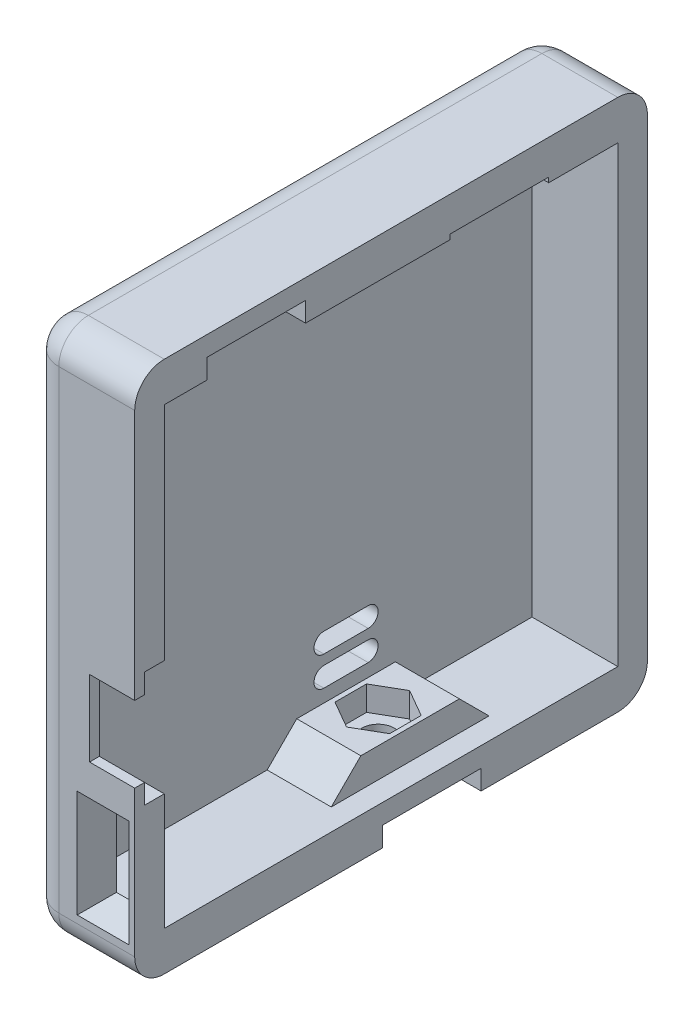
from build123d import *

# Parameters (mm, degrees)
CROQUIS1_W                   = 3.246579248
CROQUIS1_H                   = 8.852829877
SALIENTE_EXTRUIR1_DEPTH      = 2
CROQUIS5_W                   = 9
CROQUIS5_H                   = 0.5
ARREGLO_IMPRESION1_DEPTH     = 2
CROQUIS6_W                   = 9
CROQUIS6_H                   = 48
SALIENTE_EXTRUIR4_DEPTH      = 2
CROQUIS7_W                   = 9
CROQUIS7_H                   = 48
SALIENTE_EXTRUIR5_DEPTH      = 2
CROQUIS8_W                   = 9
CROQUIS8_H                   = 50
SALIENTE_EXTRUIR6_DEPTH      = 2
SALIENTE_EXTRUIR7_DEPTH      = 1.7
SALIENTE_EXTRUIR7_DEPTH_BACK = 0.3
CROQUIS9_W                   = 50
CROQUIS9_H                   = 50
CROQUIS10_W                  = 10
CROQUIS10_H                  = 0.5
CORTAR_EXTRUIR1_DEPTH        = 8.700001
CROQUIS11_W                  = 3.246579248
CROQUIS11_H                  = 8.852829877
SALIENTE_EXTRUIR8_DEPTH      = 1
CROQUIS12_W                  = 10.7
CROQUIS12_H                  = 51
SALIENTE_EXTRUIR9_DEPTH      = 2
CROQUIS13_W                  = 10.7
CROQUIS13_H                  = 52
SALIENTE_EXTRUIR10_DEPTH     = 1
CROQUIS14_W                  = 10.7
CROQUIS14_H                  = 52
SALIENTE_EXTRUIR11_DEPTH     = 2
SALIENTE_EXTRUIR12_DEPTH     = 6.5
CORTAR_EXTRUIR2_START        = -7
CROQUIS19_R                  = 1.625
CORTAR_EXTRUIR2_DEPTH        = 7
CORTAR_EXTRUIR3_DEPTH        = 2.5
CROQUIS22_W                  = 10
CROQUIS22_H                  = 2
CORTAR_EXTRUIR4_DEPTH        = 8.7
CORTAR_EXTRUIR5_START        = -10.7
CORTAR_EXTRUIR5_DEPTH        = 10.7
REDONDEO4_R                  = 3
CROQUIS24_W                  = 5.246579248
CROQUIS24_H                  = 10.87000641
CORTAR_EXTRUIR6_DEPTH        = 3
CORTAR_EXTRUIR6_DRAFT        = -18
CROQUIS25_W                  = 6.58
CROQUIS25_H                  = 11.7
CORTAR_EXTRUIR7_DEPTH        = 2


with BuildPart() as part:
    # Croquis1 → Saliente-Extruir1 (new body)
    with BuildSketch(Plane.XY):
        Polygon((47.144751496, 21.933935563), (38.144751496, 21.933935563), (38.144751496, -23.066064437), (47.144751496, -23.066064437), (47.144751496, -9.741064437), (42.564751496, -9.741064437), (42.564751496, -2.041064437), (47.144751496, -2.041064437), align=None)
        with Locations((43.941461872, -18.353940173)):
            Rectangle(CROQUIS1_W, CROQUIS1_H, mode=Mode.SUBTRACT)
    extrude(amount=SALIENTE_EXTRUIR1_DEPTH)

    # Croquis5 → Arreglo_impresion1 (add)
    with BuildSketch(Plane.XY.offset(2)):
        with Locations((42.644751496, -23.316064437)):
            Rectangle(CROQUIS5_W, CROQUIS5_H)
        with Locations((42.644751496, 22.183935563)):
            Rectangle(CROQUIS5_W, CROQUIS5_H)
    extrude(amount=-ARREGLO_IMPRESION1_DEPTH)

    # Croquis6 → Saliente-Extruir4 (add)
    with BuildSketch(Plane.XZ.offset(23.566064437)):
        with Locations((42.644751496, -22)):
            Rectangle(CROQUIS6_W, CROQUIS6_H)
    extrude(amount=SALIENTE_EXTRUIR4_DEPTH)

    # Croquis7 → Saliente-Extruir5 (add)
    with BuildSketch(Plane(origin=(0, 0, -46), x_dir=(-1, 0, 0), z_dir=(0, 0, -1))):
        with Locations((-42.644751496, -1.566064437)):
            Rectangle(CROQUIS7_W, CROQUIS7_H)
    extrude(amount=SALIENTE_EXTRUIR5_DEPTH)

    # Croquis8 → Saliente-Extruir6 (add)
    with BuildSketch(Plane(origin=(0, 22.433935563, 0), x_dir=(1, 0, 0), z_dir=(0, 1, 0))):
        with Locations((42.644751496, 23)):
            Rectangle(CROQUIS8_W, CROQUIS8_H)
    extrude(amount=SALIENTE_EXTRUIR6_DEPTH)

    # Croquis9 → Saliente-Extruir7 (add, two sides: drawn at the far end of the back side and taken through both)
    with BuildSketch(Plane.ZY.offset(-38.144751496).offset(-SALIENTE_EXTRUIR7_DEPTH_BACK)):
        with Locations((-23, -0.566064437)):
            Rectangle(CROQUIS9_W, CROQUIS9_H)
        with BuildLine():
            Line((-29.385, -14.254496437), (-24.885, -14.254496437))
            ThreePointArc((-24.885, -14.254496437), (-23.885, -15.254496437), (-24.885, -16.254496437))
            Line((-24.885, -16.254496437), (-29.385, -16.254496437))
            ThreePointArc((-29.385, -16.254496437), (-30.385, -15.254496437), (-29.385, -14.254496437))
        make_face(mode=Mode.SUBTRACT)
        with BuildLine():
            Line((-29.385, -17.254496437), (-24.885, -17.254496437))
            ThreePointArc((-24.885, -17.254496437), (-23.885, -18.254496437), (-24.885, -19.254496437))
            Line((-24.885, -19.254496437), (-29.385, -19.254496437))
            ThreePointArc((-29.385, -19.254496437), (-30.385, -18.254496437), (-29.385, -17.254496437))
        make_face(mode=Mode.SUBTRACT)
    extrude(amount=SALIENTE_EXTRUIR7_DEPTH + SALIENTE_EXTRUIR7_DEPTH_BACK)

    # Croquis10 → Cortar-Extruir1 (cut)
    with BuildSketch(Plane(origin=(47.144751496, 0, 0), x_dir=(0, 0, -1), z_dir=(1, 0, 0))):
        with Locations((33.991483973, 22.683935563)):
            Rectangle(CROQUIS10_W, CROQUIS10_H)
    extrude(amount=-CORTAR_EXTRUIR1_DEPTH, mode=Mode.SUBTRACT)

    # Croquis11 → Saliente-Extruir8 (add)
    with BuildSketch(Plane.XY.offset(2)):
        Polygon((47.144751496, 24.433935563), (36.444751496, 24.433935563), (36.444751496, -25.566064437), (47.144751496, -25.566064437), (47.144751496, -9.741064437), (42.564751496, -9.741064437), (42.564751496, -2.041064437), (47.144751496, -2.041064437), align=None)
        with Locations((43.941461872, -18.353940173)):
            Rectangle(CROQUIS11_W, CROQUIS11_H, mode=Mode.SUBTRACT)
    extrude(amount=SALIENTE_EXTRUIR8_DEPTH)

    # Croquis12 → Saliente-Extruir9 (add)
    with BuildSketch(Plane.XZ.offset(25.566064437)):
        with Locations((41.794751496, -22.5)):
            Rectangle(CROQUIS12_W, CROQUIS12_H)
    extrude(amount=SALIENTE_EXTRUIR9_DEPTH)

    # Croquis13 → Saliente-Extruir10 (add)
    with BuildSketch(Plane(origin=(0, 0, -48), x_dir=(-1, 0, 0), z_dir=(0, 0, -1))):
        with Locations((-41.794751496, -1.566064437)):
            Rectangle(CROQUIS13_W, CROQUIS13_H)
    extrude(amount=SALIENTE_EXTRUIR10_DEPTH)

    # Croquis14 → Saliente-Extruir11 (add)
    with BuildSketch(Plane(origin=(0, 24.433935563, 0), x_dir=(1, 0, 0), z_dir=(0, 1, 0))):
        with Locations((41.794751496, 23)):
            Rectangle(CROQUIS14_W, CROQUIS14_H)
    extrude(amount=SALIENTE_EXTRUIR11_DEPTH)

    # Croquis17 → Saliente-Extruir12 (add)
    with BuildSketch(Plane(origin=(38.444751496, 0, 0), x_dir=(0, 0, -1), z_dir=(1, 0, 0))):
        Polygon((22.135, -20.566064437), (32.135, -20.566064437), (35.135, -23.566064437), (19.135, -23.566064437), align=None)
    extrude(amount=SALIENTE_EXTRUIR12_DEPTH)

    # Croquis19 → Cortar-Extruir2 (cut)
    with BuildSketch(Plane(origin=(0, -20.566064437, 0), x_dir=(1, 0, 0), z_dir=(0, 1, 0)).offset(CORTAR_EXTRUIR2_START)):
        with Locations(Location((41.694751496, 27.135, 0), (0, 0, 270))):
            Circle(CROQUIS19_R)
    extrude(amount=CORTAR_EXTRUIR2_DEPTH, mode=Mode.SUBTRACT)

    # Croquis20 → Cortar-Extruir3 (cut)
    with BuildSketch(Plane(origin=(0, -20.566064437, 0), x_dir=(1, 0, 0), z_dir=(0, 1, 0))):
        Polygon((41.694751496, 30.335), (38.923470204, 28.735), (38.923470204, 25.535), (41.694751496, 23.935), (44.466032788, 25.535), (44.466032788, 28.735), align=None)
    extrude(amount=-CORTAR_EXTRUIR3_DEPTH, mode=Mode.SUBTRACT)

    # Croquis22 → Cortar-Extruir4 (cut)
    with BuildSketch(Plane(origin=(47.144751496, 0, 0), x_dir=(0, 0, -1), z_dir=(1, 0, 0))):
        with Locations((27.135, -26.566064437)):
            Rectangle(CROQUIS22_W, CROQUIS22_H)
        with Locations((9.331412976, 23.433935563)):
            Rectangle(CROQUIS22_W, CROQUIS22_H)
    extrude(amount=-CORTAR_EXTRUIR4_DEPTH, mode=Mode.SUBTRACT)

    # Croquis23 → Cortar-Extruir5 (cut)
    with BuildSketch(Plane(origin=(47.144751496, 0, 0), x_dir=(0, 0, -1), z_dir=(1, 0, 0)).offset(CORTAR_EXTRUIR5_START)):
        with BuildLine():
            Line((-3, -27.566064437), (0, -27.566064437))
            ThreePointArc((0, -27.566064437), (-2.121320344, -26.687384781), (-3, -24.566064437))
            Line((-3, -24.566064437), (-3, -27.566064437))
        make_face()
        with BuildLine():
            Line((-3, 26.433935563), (0, 26.433935563))
            ThreePointArc((0, 26.433935563), (-2.121320344, 25.555255907), (-3, 23.433935563))
            Line((-3, 23.433935563), (-3, 26.433935563))
        make_face()
        with BuildLine():
            Line((49, 26.433935563), (49, 23.433935563))
            ThreePointArc((49, 23.433935563), (48.121320344, 25.555255907), (46, 26.433935563))
            Line((46, 26.433935563), (49, 26.433935563))
        make_face()
        with BuildLine():
            Line((49, -27.566064437), (46, -27.566064437))
            ThreePointArc((46, -27.566064437), (48.121320344, -26.687384781), (49, -24.566064437))
            Line((49, -24.566064437), (49, -27.566064437))
        make_face()
    extrude(amount=CORTAR_EXTRUIR5_DEPTH, mode=Mode.SUBTRACT)

    # Redondeo4
    # the kernel refuses this fillet: 3 mm, written as the material it takes off along each edge
    with BuildSketch(Plane(origin=(36.444751496, -24.566064437, 0), x_dir=(0, -1, 0), z_dir=(0, 0, -1))) as redondeo4_piece_1:
        with BuildLine():
            CenterArc((3 - REDONDEO4_R, -REDONDEO4_R), REDONDEO4_R, 360, 90)
            Line((3, -REDONDEO4_R), (3, 0))
            Line((3, 0), (3 - REDONDEO4_R, 0))
        make_face()
    revolve(axis=Axis((36.444751496, -24.566064437, 0), (-1, 0, 0)), revolution_arc=90, mode=Mode.SUBTRACT)
    with BuildSketch(Plane(origin=(36.444751496, -24.566064437, 3), x_dir=(0, 0, -1), z_dir=(0, 1, 0)), Plane(origin=(36.444751496, 23.433935563, -49), x_dir=(0, 0, 1), z_dir=(0, -1, 0))) as redondeo4_piece_2:
        with BuildLine():
            CenterArc((REDONDEO4_R, -REDONDEO4_R), REDONDEO4_R, 90, 90)
            Line((0, -REDONDEO4_R), (0, 0))
            Line((0, 0), (REDONDEO4_R, 0))
        make_face()
    extrude(amount=48, mode=Mode.SUBTRACT)
    with BuildSketch(Plane(origin=(36.444751496, 23.433935563, 0), x_dir=(0, 1, 0), z_dir=(0, 0, -1))) as redondeo4_piece_3:
        with BuildLine():
            CenterArc((3 - REDONDEO4_R, REDONDEO4_R), REDONDEO4_R, 270, 90)
            Line((3, REDONDEO4_R), (3, 0))
            Line((3, 0), (3 - REDONDEO4_R, 0))
        make_face()
    revolve(axis=Axis((36.444751496, 23.433935563, 0), (1, 0, 0)), revolution_arc=90, mode=Mode.SUBTRACT)
    with BuildSketch(Plane(origin=(36.444751496, 26.433935563, -46), x_dir=(0, -1, 0), z_dir=(0, 0, 1))) as redondeo4_piece_4:
        with BuildLine():
            CenterArc((REDONDEO4_R, REDONDEO4_R), REDONDEO4_R, 180, 90)
            Line((0, REDONDEO4_R), (0, 0))
            Line((0, 0), (REDONDEO4_R, 0))
        make_face()
    extrude(amount=46, mode=Mode.SUBTRACT)
    with BuildSketch(Plane(origin=(36.444751496, 23.433935563, -46), x_dir=(0, 0, -1), z_dir=(0, -1, 0))) as redondeo4_piece_5:
        with BuildLine():
            CenterArc((3 - REDONDEO4_R, REDONDEO4_R), REDONDEO4_R, 270, 90)
            Line((3, REDONDEO4_R), (3, 0))
            Line((3, 0), (3 - REDONDEO4_R, 0))
        make_face()
    revolve(axis=Axis((36.444751496, 23.433935563, -46), (1, 0, 0)), revolution_arc=90, mode=Mode.SUBTRACT)
    with BuildSketch(Plane(origin=(36.444751496, -24.566064437, -46), x_dir=(0, -1, 0), z_dir=(0, 0, 1))) as redondeo4_piece_6:
        with BuildLine():
            CenterArc((3 - REDONDEO4_R, REDONDEO4_R), REDONDEO4_R, 270, 90)
            Line((3, REDONDEO4_R), (3, 0))
            Line((3, 0), (3 - REDONDEO4_R, 0))
        make_face()
    revolve(axis=Axis((36.444751496, -24.566064437, -46), (1, 0, 0)), revolution_arc=90, mode=Mode.SUBTRACT)
    with BuildSketch(Plane(origin=(36.444751496, -27.566064437, -46), x_dir=(0, 1, 0), z_dir=(0, 0, 1))) as redondeo4_piece_7:
        with BuildLine():
            CenterArc((REDONDEO4_R, -REDONDEO4_R), REDONDEO4_R, 90, 90)
            Line((0, -REDONDEO4_R), (0, 0))
            Line((0, 0), (REDONDEO4_R, 0))
        make_face()
    extrude(amount=46, mode=Mode.SUBTRACT)


with BuildPart() as cortar_extruir6_tool:
    # Croquis24 → Cortar-Extruir6 (with draft: the straight prism first)
    with BuildSketch(Plane.XY.offset(3)):
        with Locations((43.941461872, -18.36252844)):
            Rectangle(CROQUIS24_W, CROQUIS24_H)
    extrude(amount=-CORTAR_EXTRUIR6_DEPTH)
    # Cortar-Extruir6: the draft: its side faces are tilted about the plane it starts from
    cortar_extruir6_sides = [cortar_extruir6_tool.faces().sort_by_distance(p)[0] for p in [
        (43.941461872, -23.797531645, 1.5),
        (46.564751496, -18.36252844, 1.5),
        (43.941461872, -12.927525235, 1.5),
        (41.318172248, -18.36252844, 1.5),
    ]]
    draft(cortar_extruir6_sides, Plane.XY.offset(3), CORTAR_EXTRUIR6_DRAFT)


with BuildPart() as part_1:
    add(part.part)

    # Cortar-Extruir6: cut by cortar_extruir6_tool
    add(cortar_extruir6_tool.part, mode=Mode.SUBTRACT)

    # Croquis25 → Cortar-Extruir7 (cut)
    with BuildSketch(Plane(origin=(0, 0, 0), x_dir=(-1, 0, 0), z_dir=(0, 0, -1))):
        with Locations((-43.854751496, -5.891064437)):
            Rectangle(CROQUIS25_W, CROQUIS25_H)
    extrude(amount=-CORTAR_EXTRUIR7_DEPTH, mode=Mode.SUBTRACT)


solid = part_1.part
